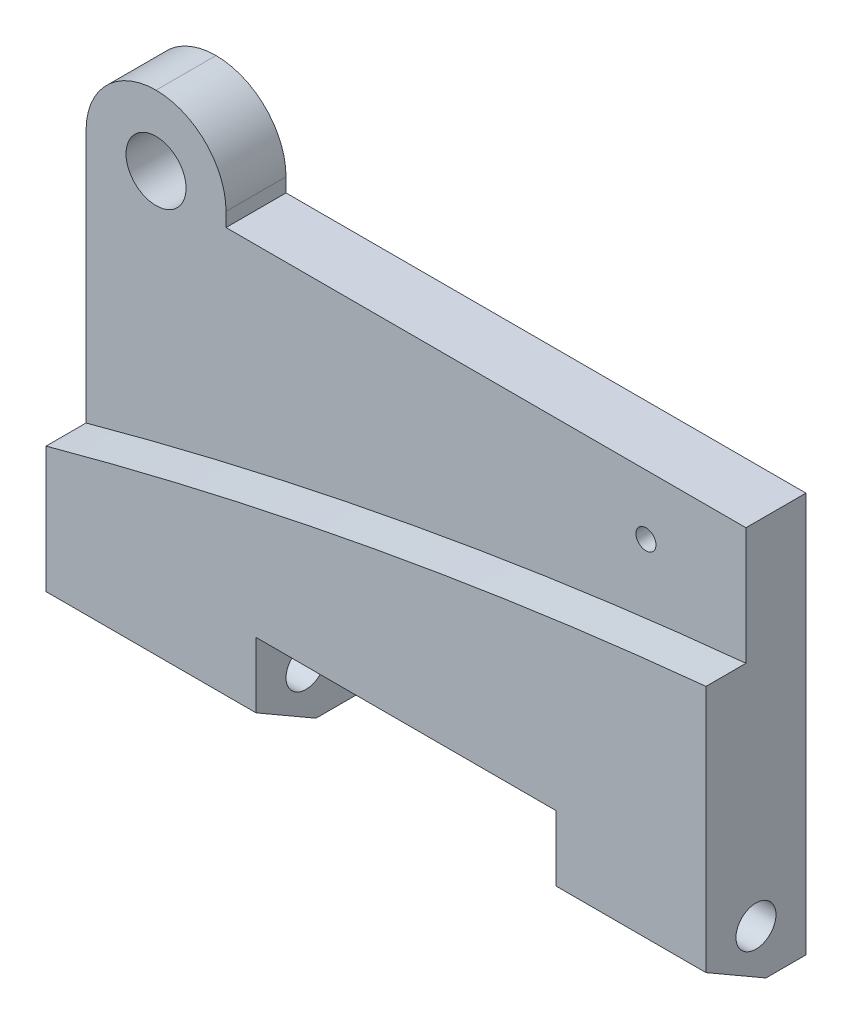
from build123d import *
from OCP.BRepFilletAPI import BRepFilletAPI_MakeChamfer

# Parameters (mm, degrees)
RESSALTO_EXTRUS_O1_DEPTH = 5
ESBO_O2_R                = 1
CORTE_EXTRUS_O1_DEPTH    = 35.84250278
CORTE_EXTRUS_O2_DEPTH    = 2
SKETCH1_R                = 0.5
CUT_EXTRUDE1_DEPTH       = 20.931131428
SKETCH2_W                = 7
SKETCH2_H                = 3
BOSS_EXTRUDE1_DEPTH      = 4.2
SKETCH3_R                = 1.5
CUT_EXTRUDE2_DEPTH       = 23.33584563
FILLET2_R                = 3.5
CHAMFER1_SIZE            = 3
CHAMFER1_SIZE2           = 1.732050808


with BuildPart() as part:
    # Esboço1 → Ressalto-extrusão1 (new body)
    with BuildSketch(Plane.XY):
        Polygon((9, -10), (16.5, -10), (16.5, 10), (-16.5, 10), (-16.5, -10), (-6, -10), (-6, -5), (9, -5), align=None)
    extrude(amount=RESSALTO_EXTRUS_O1_DEPTH)

    # Esboço2 → Corte-extrusão1 (cut, through all)
    with BuildSketch(Plane(origin=(16.5, 0, 0), x_dir=(0, 0, -1), z_dir=(1, 0, 0))):
        with Locations((-2.5, -7.5)):
            Circle(ESBO_O2_R)
    extrude(amount=-CORTE_EXTRUS_O1_DEPTH, mode=Mode.SUBTRACT)

    # Esboço3 → Corte-extrusão2 (cut)
    with BuildSketch(Plane.XY.offset(5)):
        with BuildLine():
            Line((-16.5, 10), (-16.5, -1.963769034))
            ThreePointArc((-16.5, -1.963769034), (-0.129411774, 1.783536996), (16.5, 4.128984796))
            Line((16.5, 4.128984796), (16.5, 5.523404181))
            Line((16.5, 5.523404181), (16.5, 10))
            Line((16.5, 10), (-16.5, 10))
        make_face()
    extrude(amount=-CORTE_EXTRUS_O2_DEPTH, mode=Mode.SUBTRACT)

    # Sketch1 → Cut-Extrude1 (cut, through all)
    with BuildSketch(Plane(origin=(0, 0, 0), x_dir=(-1, 0, 0), z_dir=(0, 0, -1))):
        with Locations(Location((-11.5, 7, 0), (0, 0, 180))):
            Circle(SKETCH1_R)
    extrude(amount=-CUT_EXTRUDE1_DEPTH, mode=Mode.SUBTRACT)

    # Sketch2 → Boss-Extrude1 (add)
    with BuildSketch(Plane(origin=(0, 10, 0), x_dir=(1, 0, 0), z_dir=(0, 1, 0))):
        with Locations((-13, -1.5)):
            Rectangle(SKETCH2_W, SKETCH2_H)
    extrude(amount=BOSS_EXTRUDE1_DEPTH)

    # Sketch3 → Cut-Extrude2 (cut, through all)
    with BuildSketch(Plane(origin=(0, 0, 0), x_dir=(-1, 0, 0), z_dir=(0, 0, -1))):
        with Locations((13, 10.7)):
            Circle(SKETCH3_R)
    extrude(amount=-CUT_EXTRUDE2_DEPTH, mode=Mode.SUBTRACT)

    # Fillet2
    fillet2_edges = [part.edges().sort_by_distance(p)[0] for p in [
        (-9.5, 14.2, 1.5),
        (-16.5, 14.2, 1.5),
    ]]
    fillet(fillet2_edges, radius=FILLET2_R - 0.0001)  # a hair under: the kernel refuses the full size

    # Chamfer1: one chamfer whose edges measure the first distance from different faces: ONE call of the kernel's chamfer builder (chamfer() names one face for all edges)
    chamfer1_edges_1 = [part.edges().sort_by_distance(p)[0] for p in [
        (-11.25, -10, 5),
    ]]
    chamfer1_side_1 = [part.faces().sort_by_distance(p)[0] for p in [
        (-11.25, -10, 2.5),
    ]]
    chamfer1_edges_2 = [part.edges().sort_by_distance(p)[0] for p in [
        (12.75, -10, 5),
    ]]
    chamfer1_side_2 = [part.faces().sort_by_distance(p)[0] for p in [
        (12.75, -10, 2.5),
    ]]
    chamfer1 = BRepFilletAPI_MakeChamfer(part.part.solid().wrapped)
    for e in chamfer1_edges_1:
        chamfer1.Add(CHAMFER1_SIZE, CHAMFER1_SIZE2, e.wrapped, chamfer1_side_1[0].wrapped)  # the first distance lies on this face
    for e in chamfer1_edges_2:
        chamfer1.Add(CHAMFER1_SIZE, CHAMFER1_SIZE2, e.wrapped, chamfer1_side_2[0].wrapped)  # the first distance lies on this face
    add(Compound.cast(chamfer1.Shape()), mode=Mode.REPLACE)


solid = part.part
